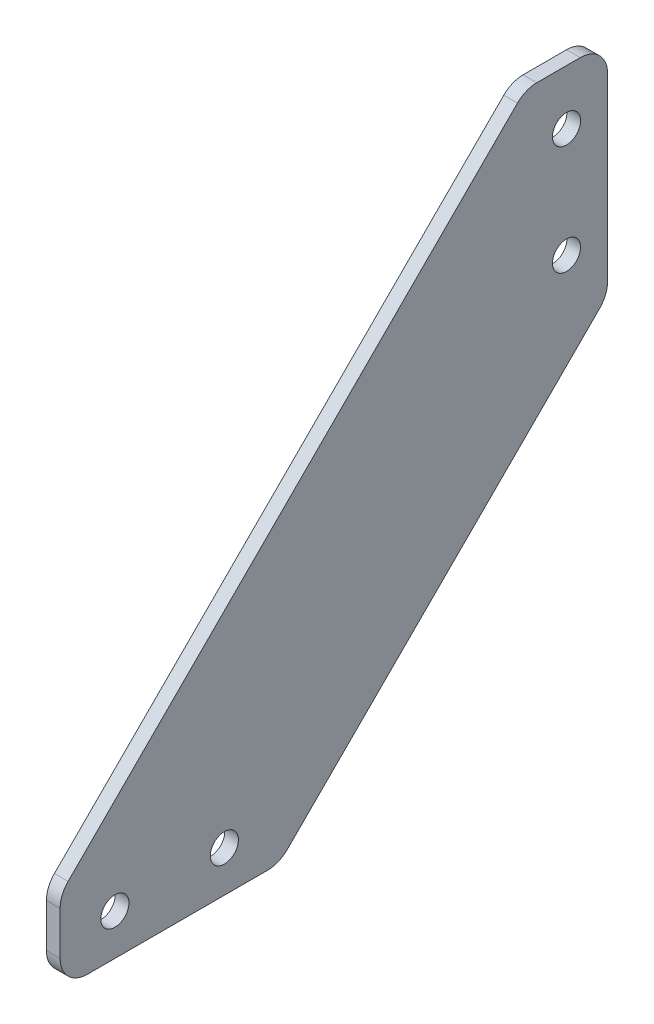
from build123d import *

# Parameters (mm, degrees)
F_1_8_IN_SHEET_METAL_DEPTH = 1.5875
F_1_4_CLEARANCE_HOLE1_D    = 6.5278
FILLET_1_4_IN_R            = 6.35


with BuildPart() as part:
    # Sketch1 → 1/8 in Sheet Metal (new, symmetric)
    with BuildSketch(Plane(origin=(0, 0, 0), x_dir=(0, 0, -1), z_dir=(1, 0, 0))):
        Polygon((0, 127), (-19.05, 127), (-127, 19.05), (-127, 0), (-76.2, 0), (0, 76.2), align=None)
    extrude(amount=F_1_8_IN_SHEET_METAL_DEPTH, both=True)

    # 1/4 Clearance Hole1 (through all)
    with Locations(Plane(origin=(1.5875, 0, 0), x_dir=(0, 0, -1), z_dir=(1, 0, 0))):
        with Locations((-114.3, 9.525), (-88.9, 9.525), (-9.525, 88.9), (-9.525, 114.3)):
            Hole(F_1_4_CLEARANCE_HOLE1_D / 2)

    # Fillet 1/4 in
    fillet_1_4_in_edges = [part.edges().sort_by_distance(p)[0] for p in [
        (0, 76.2, 0),
        (0, 127, 0),
        (0, 127, 19.05),
        (0, 19.05, 127),
        (0, 0, 76.2),
        (0, 0, 127),
    ]]
    fillet(fillet_1_4_in_edges, radius=FILLET_1_4_IN_R)


solid = part.part
